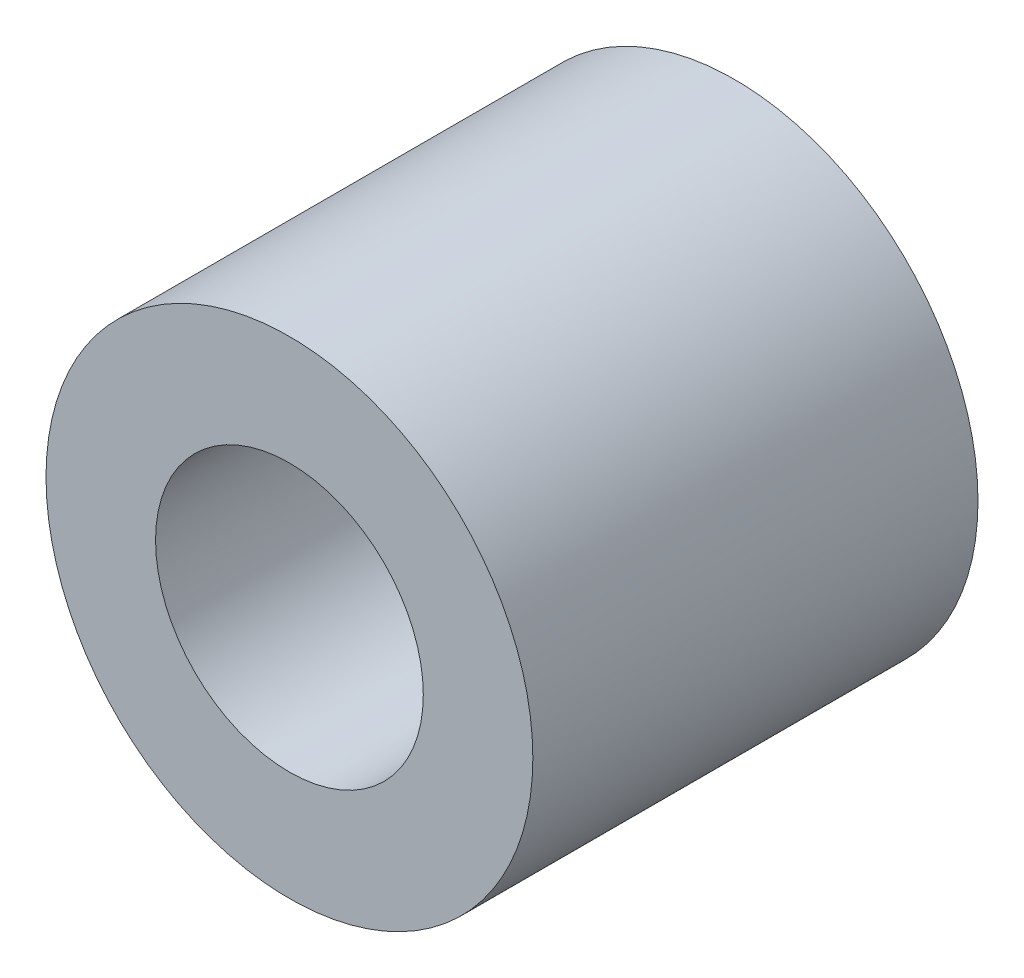
from build123d import *

# Parameters (mm, degrees)
SKETCH1_R           = 9.525
SKETCH1_R_2         = 5.23875
BOSS_EXTRUDE1_DEPTH = 8.709249917


with BuildPart() as part:
    # Sketch1 → Boss-Extrude1 (new, symmetric)
    with BuildSketch(Plane.XY):
        Circle(SKETCH1_R)
        Circle(SKETCH1_R_2, mode=Mode.SUBTRACT)
    extrude(amount=BOSS_EXTRUDE1_DEPTH, both=True)


solid = part.part
